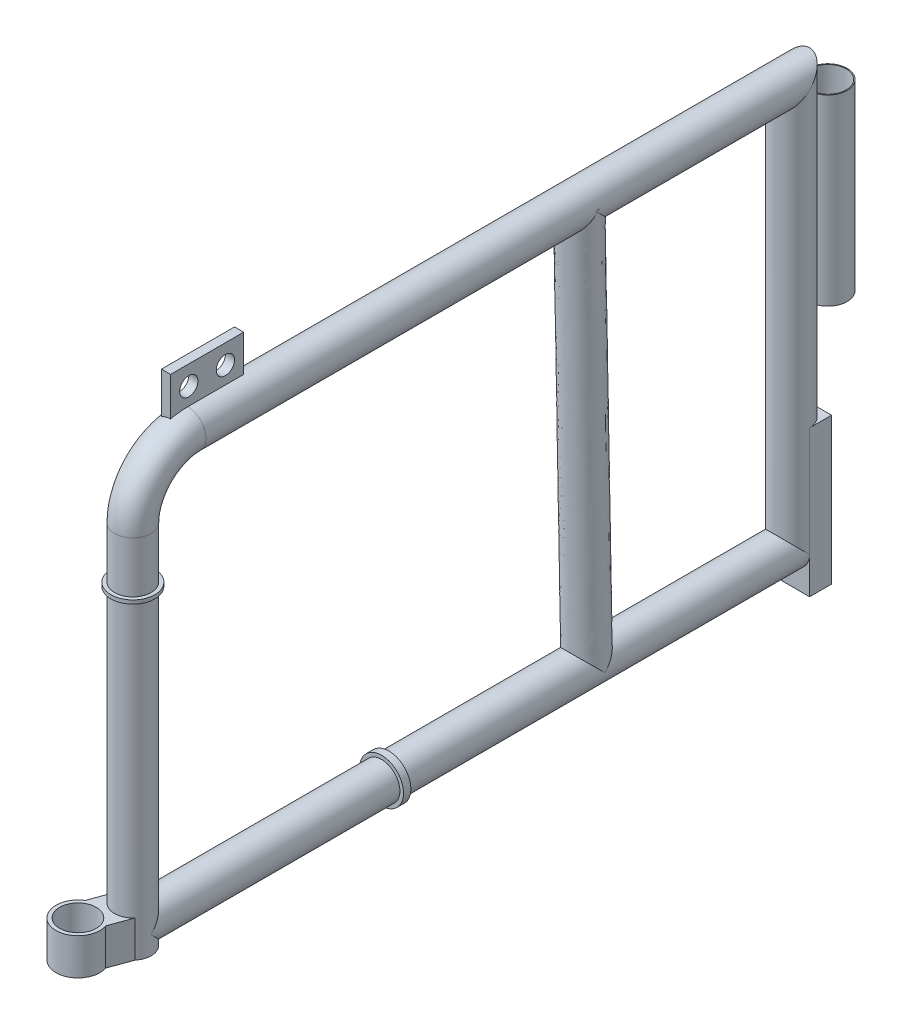
from build123d import *

# Parameters (mm, degrees)
SKETCH2_R           = 12.7
SKETCH5_R           = 12.7
SKETCH8_R           = 15.24
BOSS_EXTRUDE3_DEPTH = 5.08
SKETCH9_R           = 15.24
BOSS_EXTRUDE4_DEPTH = 5.08
SKETCH10_R          = 13.335
SKETCH10_R_2        = 12.7
BOSS_EXTRUDE5_DEPTH = 127
CUT_EXTRUDE1_START  = -78.74
SKETCH11_R          = 15.24
SKETCH11_R_2        = 12.7
CUT_EXTRUDE1_DEPTH  = 78.74
BOSS_EXTRUDE6_DEPTH = 15.24
BOSS_EXTRUDE7_START = 25.4
BOSS_EXTRUDE7_DEPTH = 25.4
SKETCH15_R          = 12.7
CUT_EXTRUDE2_DEPTH  = 574.672573165
SKETCH16_W          = 6.35
SKETCH16_H          = 50.8
BOSS_EXTRUDE8_DEPTH = 38.1
SKETCH17_R          = 6.35
CUT_EXTRUDE3_DEPTH  = 38.1
SKETCH18_R          = 15.24
BOSS_EXTRUDE9_DEPTH = 2.54


with BuildPart() as part:
    # Sweep1: sweep along a path in Sketch3
    with BuildLine(Plane(origin=(0, 0, 0), x_dir=(0, 0, -1), z_dir=(1, 0, 0))) as sweep1_path:
        Line((0, 0), (-457.2, 0))
        Line((-457.2, 0), (-457.2, 241.3))
        ThreePointArc((-457.2, 241.3), (-446.040768363, 268.240768363), (-419.1, 279.4))
        Line((-419.1, 279.4), (0, 279.4))
        Line((0, 279.4), (0, 0))
    # Sketch2 → Sweep1 (sweep)
    with BuildSketch(Plane.XY):
        Circle(SKETCH2_R)
    sweep(path=sweep1_path.line, transition=Transition.RIGHT)

    # Sweep2: sweep along a path in Sketch4
    with BuildLine(Plane(origin=(0, 0, 0), x_dir=(0, 0, -1), z_dir=(1, 0, 0))) as sweep2_path:
        Line((-142.063950703, 0), (-147.331360877, 280.791318963))
    # Sketch5 → Sweep2 (sweep)
    with BuildSketch(Plane(origin=(0, 0, 0), x_dir=(1, 0, 0), z_dir=(0, 1, 0))):
        with Locations((0, -142.063950703)):
            Circle(SKETCH5_R)
    sweep(path=sweep2_path.line)

    # Sketch8 → Boss-Extrude3 (add)
    with BuildSketch(Plane.XY.offset(279.4)):
        Circle(SKETCH8_R)
    extrude(amount=BOSS_EXTRUDE3_DEPTH)

    # Sketch9 → Boss-Extrude4 (add)
    with BuildSketch(Plane.XY.offset(304.8)):
        with Locations((0, 279.4)):
            Circle(SKETCH9_R)
    extrude(amount=BOSS_EXTRUDE4_DEPTH)

    # Sketch10 → Boss-Extrude5 (add)
    with BuildSketch(Plane(origin=(0, 139.7, 0), x_dir=(1, 0, 0), z_dir=(0, 1, 0))):
        with Locations((0, 25.4)):
            Circle(SKETCH10_R)
        with Locations((0, 25.4)):
            Circle(SKETCH10_R_2, mode=Mode.SUBTRACT)
    extrude(amount=BOSS_EXTRUDE5_DEPTH)

    # Sketch11 → Cut-Extrude1 (cut)
    with BuildSketch(Plane.XY.offset(309.88).offset(CUT_EXTRUDE1_START)):
        with Locations((0, 279.4)):
            Circle(SKETCH11_R)
        with Locations((0, 279.4)):
            Circle(SKETCH11_R_2, mode=Mode.SUBTRACT)
    extrude(amount=CUT_EXTRUDE1_DEPTH, mode=Mode.SUBTRACT)

    # Sketch12 → Boss-Extrude6 (add)
    with BuildSketch(Plane.XY):
        Polygon((0, -25.4), (-12.7, -25.4), (-12.7, 76.2), (12.7, 76.2), (12.7, -25.4), align=None)
    extrude(amount=-BOSS_EXTRUDE6_DEPTH)

    # Sketch13 → Boss-Extrude7 (add)
    with BuildSketch(Plane(origin=(0, -12.7, 0), x_dir=(1, 0, 0), z_dir=(0, 1, 0)).offset(BOSS_EXTRUDE7_START)):
        with BuildLine():
            Line((-12.7, -457.2), (-18.14559968, -472.161662157))
            ThreePointArc((-18.14559968, -472.161662157), (-15.385315788, -499.47080772), (4.283164747, -480.3250648))
            Line((4.283164747, -480.3250648), (9.728764428, -465.363402643))
            ThreePointArc((9.728764428, -465.363402643), (4.34365582, -445.265903716), (-12.7, -457.2))
        make_face()
    extrude(amount=-BOSS_EXTRUDE7_DEPTH)

    # Sketch15 → Cut-Extrude2 (cut, through all)
    with BuildSketch(Plane(origin=(0, 12.7, 0), x_dir=(1, 0, 0), z_dir=(0, 1, 0))):
        with Locations((-10.172928804, -485.149892179)):
            Circle(SKETCH15_R)
    extrude(amount=-CUT_EXTRUDE2_DEPTH, mode=Mode.SUBTRACT)

    # Sketch16 → Boss-Extrude8 (add)
    with BuildSketch(Plane(origin=(0, 279.4, 0), x_dir=(1, 0, 0), z_dir=(0, 1, 0))):
        with Locations((-3.175, -405.638)):
            Rectangle(SKETCH16_W, SKETCH16_H)
    extrude(amount=BOSS_EXTRUDE8_DEPTH)

    # Sketch17 → Cut-Extrude3 (cut)
    with BuildSketch(Plane(origin=(0, 0, 0), x_dir=(0, 0, -1), z_dir=(1, 0, 0))):
        with Locations((-418.338, 304.088682407)):
            Circle(SKETCH17_R)
        with Locations((-392.938, 304.088682407)):
            Circle(SKETCH17_R)
    extrude(amount=-CUT_EXTRUDE3_DEPTH, mode=Mode.SUBTRACT)

    # Sketch18 → Boss-Extrude9 (add)
    with BuildSketch(Plane(origin=(0, 203.2, 0), x_dir=(1, 0, 0), z_dir=(0, 1, 0))):
        with Locations((0, -457.2)):
            Circle(SKETCH18_R)
    extrude(amount=BOSS_EXTRUDE9_DEPTH)


solid = part.part
